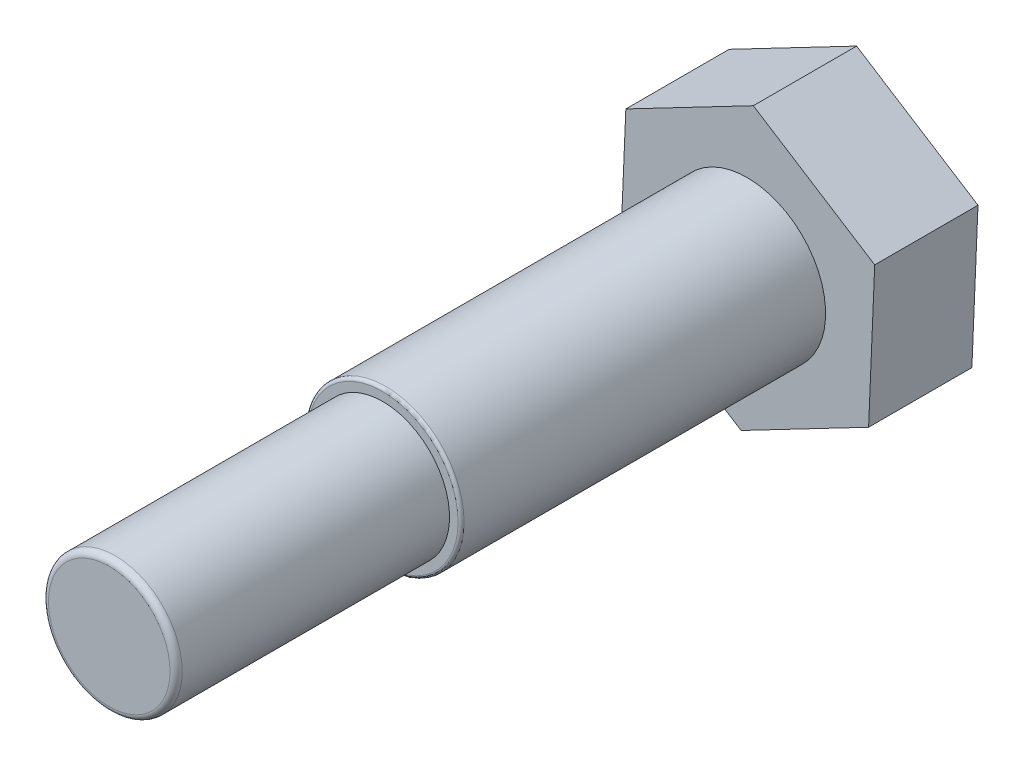
from build123d import *

# Parameters (mm, degrees)
EXTRUDE_379_DEPTH = 17
SKETCH_2_R        = 12.9
EXTRUDE_1_DEPTH   = 60
SKETCH_3_R        = 11
EXTRUDE_2_DEPTH   = 45
FILLET_2_R        = 1
FILLET_4_R        = 0.5


with BuildPart() as part:
    # 草图1 → Extrude 379 (new body)
    with BuildSketch(Plane.XY):
        Polygon((20.984201837, 10.954296262), (1.005402075, 23.65), (-19.978799762, 12.695703738), (-20.984201837, -10.954296262), (-1.005402075, -23.65), (19.978799762, -12.695703738), align=None)
    extrude(amount=EXTRUDE_379_DEPTH)

    # 草图2 → 凸台-拉伸1 (add)
    with BuildSketch(Plane.XY.offset(17)):
        Circle(SKETCH_2_R)
    extrude(amount=EXTRUDE_1_DEPTH)

    # 草图3 → 凸台-拉伸2 (add)
    with BuildSketch(Plane.XY.offset(77)):
        Circle(SKETCH_3_R)
    extrude(amount=EXTRUDE_2_DEPTH)

    # 圆角2
    fillet_2_edges = [part.edges().sort_by_distance(p)[0] for p in [
        (-11, 0, 122),
    ]]
    fillet(fillet_2_edges, radius=FILLET_2_R)

    # 圆角4
    fillet_4_edges = [part.edges().sort_by_distance(p)[0] for p in [
        (-12.9, 0, 77),
    ]]
    fillet(fillet_4_edges, radius=FILLET_4_R)


solid = part.part
